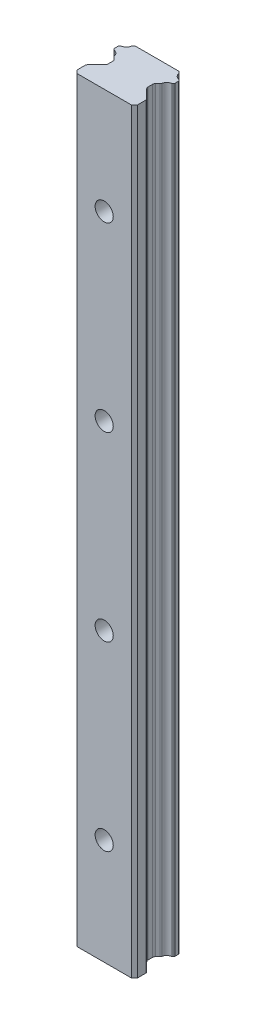
from build123d import *

# Parameters (mm, degrees)
EXTRUDE_1_DEPTH              = 250
SKETCH_80_R                  = 4.75
EXTRUDE_12_DEPTH             = 0.9
PATTERN_START                = -17.499999985
PATTERN_LINEAR_1_OUTLINE_R   = 4.75
PATTERN_LINEAR_1_DEPTH       = 0.9
PATTERN_LINEAR_1_2_OUTLINE_R = 4.75
PATTERN_LINEAR_1_2_DEPTH     = 0.9
PATTERN_LINEAR_1_3_OUTLINE_R = 4.75
PATTERN_LINEAR_1_3_DEPTH     = 0.9
PATTERN_LINEAR_1_4_OUTLINE_R = 4.75
PATTERN_LINEAR_1_4_DEPTH     = 8.499999985
PATTERN_START_2              = -9
PATTERN_LINEAR_1_5_OUTLINE_R = 3
PATTERN_LINEAR_1_5_DEPTH     = 9


# Read off the part's stored shape, not the designer's step: Линейный массив1
with BuildPart() as part:
    # Эскиз1 → Бобышка-Вытянуть1 (new body)
    with BuildSketch(Plane(origin=(0, 0, 0), x_dir=(1, 0, 0), z_dir=(0, 1, 0))):
        with BuildLine():
            Line((-10, 3.656507036), (-10, 1))
            Line((-10, 1), (-9, 0))
            Line((-9, 0), (9, 0))
            Line((9, 0), (10, 1))
            Line((10, 1), (10, 3.656507036))
            ThreePointArc((10, 3.656507036), (9.92387953, 4.039190479), (9.707106773, 4.363613837))
            Line((9.707106773, 4.363613837), (6.892893227, 7.177827383))
            ThreePointArc((6.892893227, 7.177827383), (6.67612047, 7.502250741), (6.6, 7.884934184))
            Line((6.6, 7.884934184), (6.6, 9.445065806))
            ThreePointArc((6.6, 9.445065806), (6.67612047, 9.827749249), (6.892893227, 10.152172607))
            Line((6.892893227, 10.152172607), (7.63016236, 10.88944174))
            ThreePointArc((7.63016236, 10.88944174), (7.773916172, 11.035785914), (7.84680643, 11.2275378))
            ThreePointArc((7.84680643, 11.2275378), (8.39638832, 12.26292769), (9.431778202, 12.812509595))
            ThreePointArc((9.431778202, 12.812509595), (9.571493891, 12.861817755), (9.690625709, 12.949905089))
            Line((9.690625709, 12.949905089), (9.85355341, 13.11283279))
            ThreePointArc((9.85355341, 13.11283279), (9.961939771, 13.275044443), (10, 13.466386134))
            Line((10, 13.466386134), (10, 14.523613836))
            ThreePointArc((10, 14.523613836), (9.961939771, 14.714955527), (9.85355341, 14.87716718))
            Line((9.85355341, 14.87716718), (9.678500897, 15.052219693))
            ThreePointArc((9.678500897, 15.052219693), (9.560417661, 15.139748844), (9.421985093, 15.189159641))
            ThreePointArc((9.421985093, 15.189159641), (8.395921978, 15.736919382), (7.84816224, 16.7629825))
            ThreePointArc((7.84816224, 16.7629825), (7.775191486, 16.953000828), (7.632531165, 17.098189425))
            Line((7.632531165, 17.098189425), (7.230720605, 17.499999985))
            Line((7.230720605, 17.499999985), (-7.230720615, 17.499999985))
            Line((-7.230720615, 17.499999985), (-7.632531175, 17.098189425))
            ThreePointArc((-7.632531175, 17.098189425), (-7.775191503, 16.953000832), (-7.84816225, 16.7629825))
            ThreePointArc((-7.84816225, 16.7629825), (-8.395921997, 15.736919373), (-9.421985128, 15.189159636))
            ThreePointArc((-9.421985128, 15.189159636), (-9.560417671, 15.13974885), (-9.678500884, 15.052219716))
            Line((-9.678500884, 15.052219716), (-9.85355341, 14.87716719))
            ThreePointArc((-9.85355341, 14.87716719), (-9.961939771, 14.714955537), (-10, 14.523613846))
            Line((-10, 14.523613846), (-10, 13.466386134))
            ThreePointArc((-10, 13.466386134), (-9.961939771, 13.275044443), (-9.85355341, 13.11283279))
            Line((-9.85355341, 13.11283279), (-9.690625667, 12.949905047))
            ThreePointArc((-9.690625667, 12.949905047), (-9.57149389, 12.861817745), (-9.431778248, 12.812509604))
            ThreePointArc((-9.431778248, 12.812509604), (-8.396388337, 12.262927707), (-7.84680643, 11.2275378))
            ThreePointArc((-7.84680643, 11.2275378), (-7.773916168, 11.035785916), (-7.63016236, 10.88944174))
            Line((-7.63016236, 10.88944174), (-6.892893227, 10.152172607))
            ThreePointArc((-6.892893227, 10.152172607), (-6.67612047, 9.827749249), (-6.6, 9.445065806))
            Line((-6.6, 9.445065806), (-6.6, 7.884934184))
            ThreePointArc((-6.6, 7.884934184), (-6.67612047, 7.502250741), (-6.892893227, 7.177827383))
            Line((-6.892893227, 7.177827383), (-9.707106773, 4.363613837))
            ThreePointArc((-9.707106773, 4.363613837), (-9.92387953, 4.039190479), (-10, 3.656507036))
        make_face()
    extrude(amount=-EXTRUDE_1_DEPTH)

    # Эскиз6 → Вырез-Повернуть1 (revolve, cut)
    with BuildSketch(Plane(origin=(0, 30, 0), x_dir=(0, -1, 0), z_dir=(1, 0, 0)), mode=Mode.PRIVATE) as cut_revolve_1_sk:
        Polygon((60.25, 17.499999985), (65, 17.499999985), (65, 0), (62, 0), (62, 9), (60.25, 9), align=None)
    revolve(cut_revolve_1_sk.sketch.rotate(Axis((0, -35, -17.499999985), (0, 0, 1)), 270), axis=Axis((0, -35, -17.499999985), (0, 0, 1)), mode=Mode.SUBTRACT)

    # Pattern Linear 1 4 outline → Pattern Linear 1 4 (cut)
    with BuildSketch(Plane.XY.offset(PATTERN_START)):
        with Locations((0, -95)):
            Circle(PATTERN_LINEAR_1_4_OUTLINE_R)
        with Locations((0, -155)):
            Circle(PATTERN_LINEAR_1_4_OUTLINE_R)
        with Locations((0, -215)):
            Circle(PATTERN_LINEAR_1_4_OUTLINE_R)
    extrude(amount=PATTERN_LINEAR_1_4_DEPTH, mode=Mode.SUBTRACT)

    # Pattern Linear 1 5 outline → Pattern Linear 1 5 (cut)
    with BuildSketch(Plane.XY.offset(PATTERN_START_2)):
        with Locations((0, -95)):
            Circle(PATTERN_LINEAR_1_5_OUTLINE_R)
        with Locations((0, -155)):
            Circle(PATTERN_LINEAR_1_5_OUTLINE_R)
        with Locations((0, -215)):
            Circle(PATTERN_LINEAR_1_5_OUTLINE_R)
    extrude(amount=PATTERN_LINEAR_1_5_DEPTH, mode=Mode.SUBTRACT)


with BuildPart() as body_2:
    # Эскиз80 → Бобышка-Вытянуть12 (new body)
    with BuildSketch(Plane(origin=(0, 0, -17.499999985), x_dir=(-1, 0, 0), z_dir=(0, 0, -1))):
        with Locations((0, -35)):
            Circle(SKETCH_80_R)
    extrude(amount=-EXTRUDE_12_DEPTH)


with BuildPart() as body_3:
    # Линейный массив1 outline → Линейный массив1 (new body)
    with BuildSketch(Plane.XY.offset(PATTERN_START)):
        with Locations((0, -215)):
            Circle(PATTERN_LINEAR_1_OUTLINE_R)
    extrude(amount=PATTERN_LINEAR_1_DEPTH)


with BuildPart() as body_4:
    # Pattern Linear 1 2 outline → Pattern Linear 1 2 (new body)
    with BuildSketch(Plane.XY.offset(PATTERN_START)):
        with Locations((0, -155)):
            Circle(PATTERN_LINEAR_1_2_OUTLINE_R)
    extrude(amount=PATTERN_LINEAR_1_2_DEPTH)


with BuildPart() as body_5:
    # Pattern Linear 1 3 outline → Pattern Linear 1 3 (new body)
    with BuildSketch(Plane.XY.offset(PATTERN_START)):
        with Locations((0, -95)):
            Circle(PATTERN_LINEAR_1_3_OUTLINE_R)
    extrude(amount=PATTERN_LINEAR_1_3_DEPTH)


solid = Compound([part.part, body_2.part, body_3.part, body_4.part, body_5.part])
